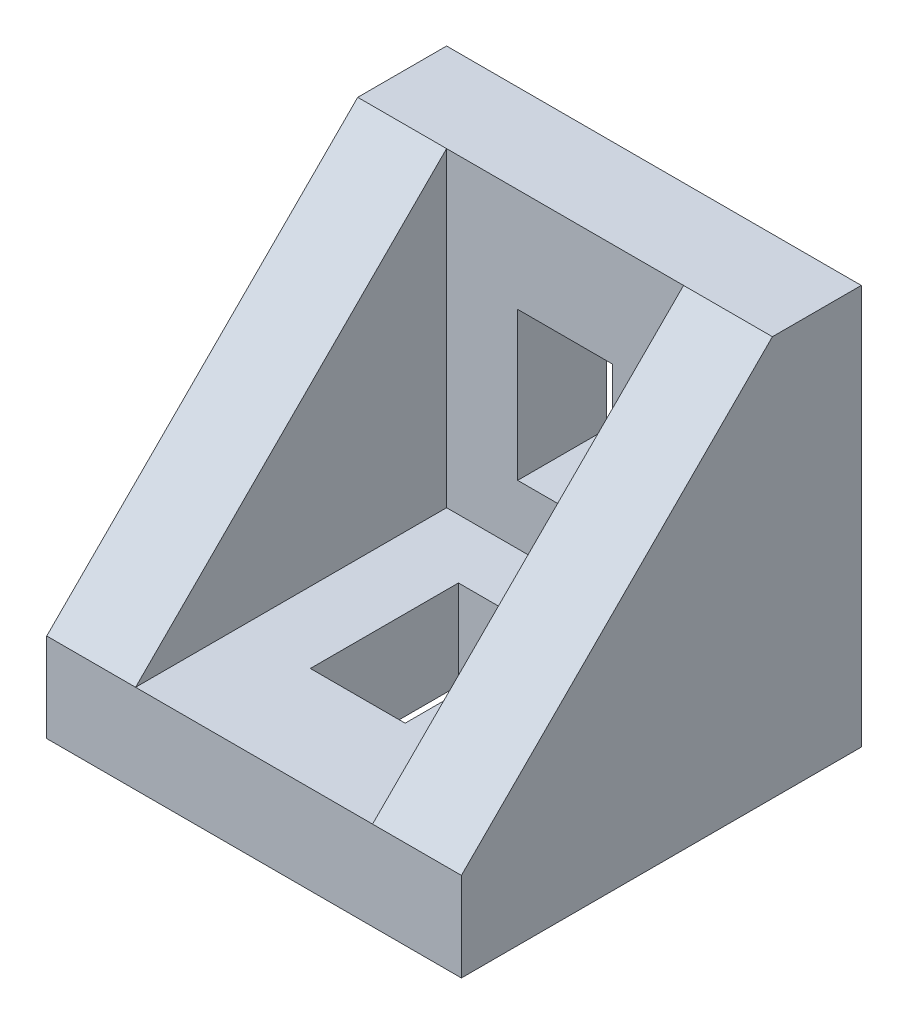
from build123d import *

# Parameters (mm, degrees)
SALIENTE_EXTRUIR1_DEPTH = 28
VACIADO2_START          = 6
VACIADO2_OUTLINE_W      = 16
VACIADO2_OUTLINE_H      = 23
VACIADO2_DEPTH          = 21
CORTAR_EXTRUIR1_REACH   = 46.204
CROQUIS2_W              = 6.4
CROQUIS2_H              = 10
CORTAR_EXTRUIR2_REACH   = 46.204
CROQUIS4_W              = 6.4
CROQUIS4_H              = 10


# Read off the part's stored shape, not the designer's step: Vaciado2
with BuildPart() as part:
    # Croquis1 → Saliente-Extruir1 (new body)
    with BuildSketch(Plane(origin=(0, 0, 0), x_dir=(0, 0, -1), z_dir=(1, 0, 0))):
        Polygon((0, 0), (27, 0), (27, 27), (21, 27), (0, 6), align=None)
    extrude(amount=SALIENTE_EXTRUIR1_DEPTH)

    # Vaciado2 outline → Vaciado2 (cut)
    with BuildSketch(Plane(origin=(0, 0, 0), x_dir=(1, 0, 0), z_dir=(0, 1, 0)).offset(VACIADO2_START)):
        with Locations((14, 9.5)):
            Rectangle(VACIADO2_OUTLINE_W, VACIADO2_OUTLINE_H)
    extrude(amount=VACIADO2_DEPTH, mode=Mode.SUBTRACT)

    # Croquis2 → Cortar-Extruir1 (cut, up to next)
    with BuildSketch(Plane.XY.offset(-21), mode=Mode.PRIVATE) as cortar_extruir1_sk1:
        with Locations((14, 15)):
            Rectangle(CROQUIS2_W, CROQUIS2_H)
    cortar_extruir1_tool1 = extrude(cortar_extruir1_sk1.sketch, amount=-CORTAR_EXTRUIR1_REACH, mode=Mode.PRIVATE) & part.part
    add(cortar_extruir1_tool1.solids().sort_by_distance((14, 15, -21))[0], mode=Mode.SUBTRACT)

    # Croquis4 → Cortar-Extruir2 (cut, up to next)
    with BuildSketch(Plane(origin=(0, 6, 0), x_dir=(1, 0, 0), z_dir=(0, 1, 0)), mode=Mode.PRIVATE) as cortar_extruir2_sk1:
        with Locations((14, 12)):
            Rectangle(CROQUIS4_W, CROQUIS4_H)
    cortar_extruir2_tool1 = extrude(cortar_extruir2_sk1.sketch, amount=-CORTAR_EXTRUIR2_REACH, mode=Mode.PRIVATE) & part.part
    add(cortar_extruir2_tool1.solids().sort_by_distance((14, 6, -12))[0], mode=Mode.SUBTRACT)


solid = part.part
